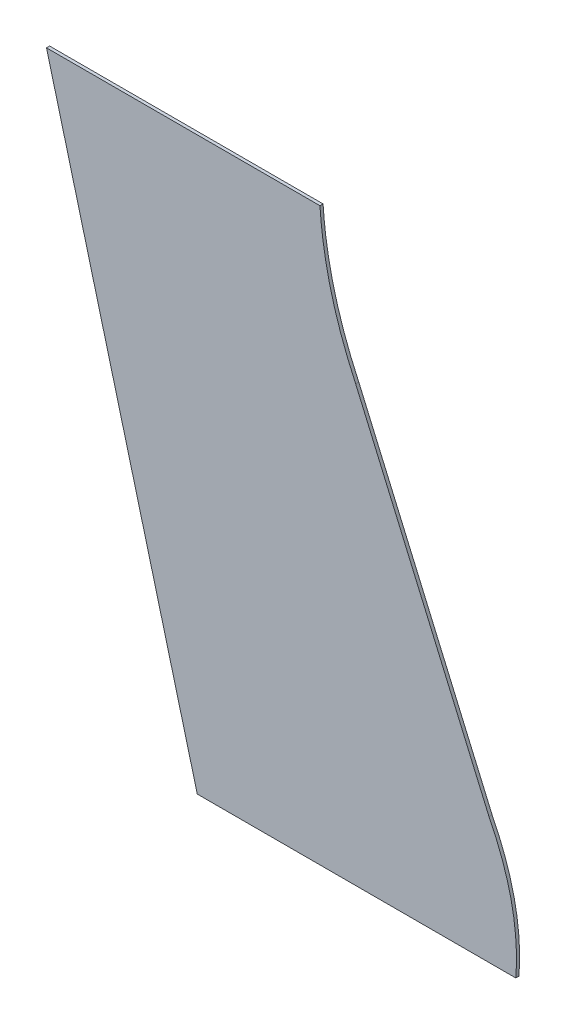
from build123d import *

# Parameters (mm, degrees)
BOSS_EXTRUDE1_DEPTH = 3


with BuildPart() as part:
    # Sketch1 → Boss-Extrude1 (new body)
    with BuildSketch(Plane.XY):
        with BuildLine():
            Line((2039.207540752, -617.805730904), (2167.618974302, -914.559348803))
            add(Edge.make_bspline(
                [(2167.618974302, -914.559348803), (2198.319341752, -975.351629991), (2193.461162107, -1036.3301284)],
                knots=[0, 0, 0, 0.705420554, 0.705420554, 0.705420554], degree=2))
            Line((2193.461162107, -1036.3301284), (1886.611152081, -1036.316980599))
            Line((1886.611152081, -1036.316980599), (1741.319397523, -486.314340755))
            Line((1741.319397523, -486.314340755), (2004.806504265, -486.314340755))
            add(Edge.make_bspline(
                [(2039.207540752, -617.805730904), (2009.133522925, -553.501288567), (2004.806504265, -486.314340755)],
                knots=[0, 0, 0, 0.66234299, 0.66234299, 0.66234299], degree=2))
        make_face()
    extrude(amount=BOSS_EXTRUDE1_DEPTH)


solid = part.part
